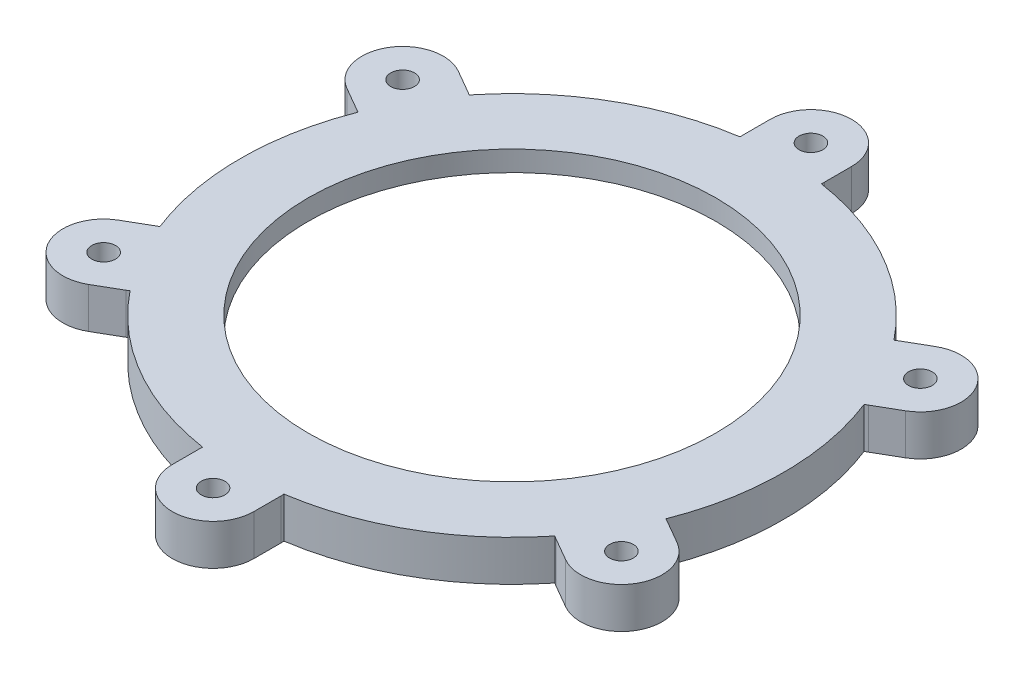
from build123d import *

# Parameters (mm, degrees)
SKETCH1_R           = 30
SKETCH1_R_2         = 1.75
BOSS_EXTRUDE1_DEPTH = 6
SKETCH6_R           = 36
CUT_EXTRUDE2_DEPTH  = 3


with BuildPart() as part:
    # Sketch1 → Boss-Extrude1 (new body)
    with BuildSketch(Plane(origin=(0, 0, 0), x_dir=(1, 0, 0), z_dir=(0, 1, 0))):
        with BuildLine():
            Line((-6, 40), (-6, 44))
            ThreePointArc((-6, 44), (0, 50), (6, 44))
            Line((6, 44), (6, 40))
            ThreePointArc((6, 40), (5.995773812, 39.774841406), (5.983101203, 39.55))
            ThreePointArc((5.983101203, 39.55), (20, 34.641016151), (31.259754118, 24.956517635))
            ThreePointArc((31.259754118, 24.956517635), (31.448136183, 25.07991314), (31.641016151, 25.196152423))
            Line((31.641016151, 25.196152423), (35.105117767, 27.196152423))
            ThreePointArc((35.105117767, 27.196152423), (43.301270189, 25), (41.105117767, 16.803847577))
            Line((41.105117767, 16.803847577), (37.641016151, 14.803847577))
            ThreePointArc((37.641016151, 14.803847577), (37.443909995, 14.694928266), (37.242855321, 14.593482365))
            ThreePointArc((37.242855321, 14.593482365), (40, 0), (37.242855321, -14.593482365))
            ThreePointArc((37.242855321, -14.593482365), (37.443909995, -14.694928266), (37.641016151, -14.803847577))
            Line((37.641016151, -14.803847577), (41.105117767, -16.803847577))
            ThreePointArc((41.105117767, -16.803847577), (43.301270189, -25), (35.105117767, -27.196152423))
            Line((35.105117767, -27.196152423), (31.641016151, -25.196152423))
            ThreePointArc((31.641016151, -25.196152423), (31.448136183, -25.07991314), (31.259754118, -24.956517635))
            ThreePointArc((31.259754118, -24.956517635), (20, -34.641016151), (5.983101203, -39.55))
            ThreePointArc((5.983101203, -39.55), (5.995773812, -39.774841406), (6, -40))
            Line((6, -40), (6, -44))
            ThreePointArc((6, -44), (0, -50), (-6, -44))
            Line((-6, -44), (-6, -40))
            ThreePointArc((-6, -40), (-5.995773812, -39.774841406), (-5.983101203, -39.55))
            ThreePointArc((-5.983101203, -39.55), (-20, -34.641016151), (-31.259754118, -24.956517635))
            ThreePointArc((-31.259754118, -24.956517635), (-31.448136183, -25.07991314), (-31.641016151, -25.196152423))
            Line((-31.641016151, -25.196152423), (-35.105117767, -27.196152423))
            ThreePointArc((-35.105117767, -27.196152423), (-43.301270189, -25), (-41.105117767, -16.803847577))
            Line((-41.105117767, -16.803847577), (-37.641016151, -14.803847577))
            ThreePointArc((-37.641016151, -14.803847577), (-37.443909995, -14.694928266), (-37.242855321, -14.593482365))
            ThreePointArc((-37.242855321, -14.593482365), (-40, 0), (-37.242855321, 14.593482365))
            ThreePointArc((-37.242855321, 14.593482365), (-37.443909995, 14.694928266), (-37.641016151, 14.803847577))
            Line((-37.641016151, 14.803847577), (-41.105117767, 16.803847577))
            ThreePointArc((-41.105117767, 16.803847577), (-43.301270189, 25), (-35.105117767, 27.196152423))
            Line((-35.105117767, 27.196152423), (-31.641016151, 25.196152423))
            ThreePointArc((-31.641016151, 25.196152423), (-31.448136183, 25.07991314), (-31.259754118, 24.956517635))
            ThreePointArc((-31.259754118, 24.956517635), (-20, 34.641016151), (-5.983101203, 39.55))
            ThreePointArc((-5.983101203, 39.55), (-5.995773812, 39.774841406), (-6, 40))
        make_face()
        Circle(SKETCH1_R, mode=Mode.SUBTRACT)
        with Locations((0, 44)):
            Circle(SKETCH1_R_2, mode=Mode.SUBTRACT)
        with Locations((38.105117767, 22)):
            Circle(SKETCH1_R_2, mode=Mode.SUBTRACT)
        with Locations((38.105117767, -22)):
            Circle(SKETCH1_R_2, mode=Mode.SUBTRACT)
        with Locations((0, -44)):
            Circle(SKETCH1_R_2, mode=Mode.SUBTRACT)
        with Locations((-38.105117767, -22)):
            Circle(SKETCH1_R_2, mode=Mode.SUBTRACT)
        with Locations((-38.105117767, 22)):
            Circle(SKETCH1_R_2, mode=Mode.SUBTRACT)
    extrude(amount=BOSS_EXTRUDE1_DEPTH)

    # Sketch6 → Cut-Extrude2 (cut)
    with BuildSketch(Plane.XZ):
        Circle(SKETCH6_R)
    extrude(amount=-CUT_EXTRUDE2_DEPTH, mode=Mode.SUBTRACT)


solid = part.part
